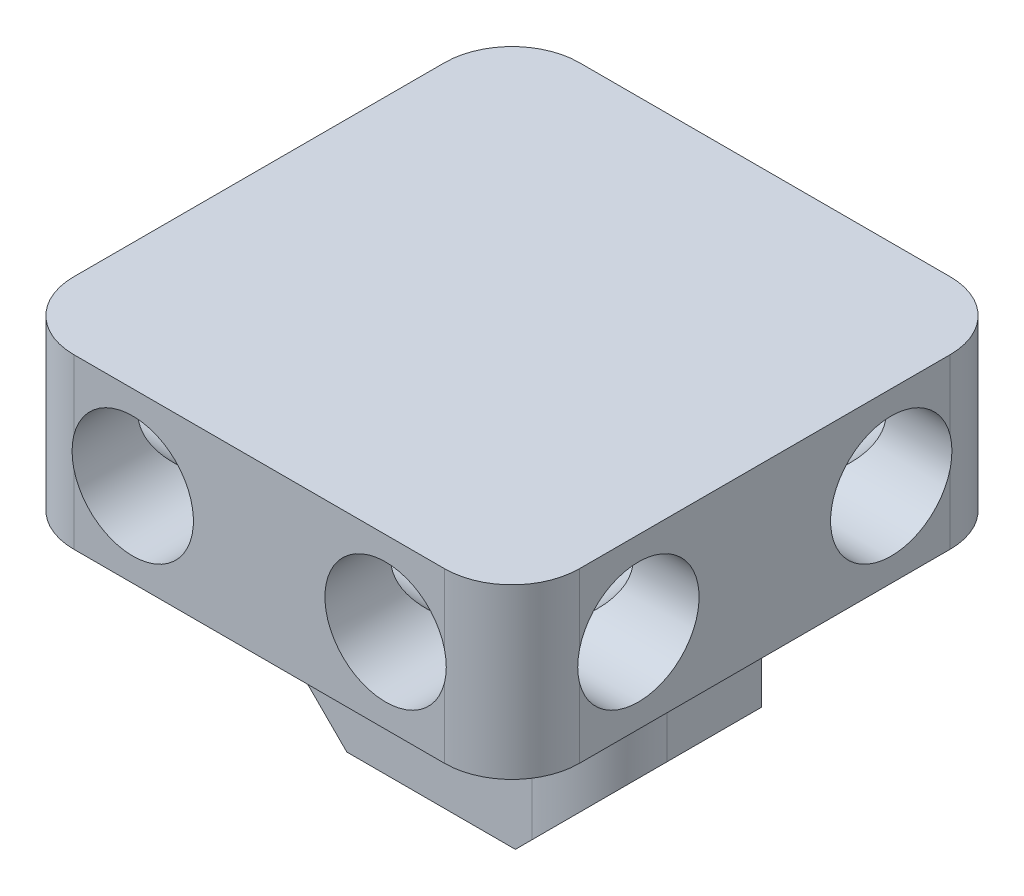
from build123d import *

# Parameters (mm, degrees)
BOSS_EXTRUDE1_DEPTH     = 6.35
CUT_EXTRUDE1_START      = -9.525
SKETCH2_R               = 2.286
SKETCH2_R_2             = 2.285999999999999
CUT_EXTRUDE1_DEPTH      = 19.05
CUT_EXTRUDE2_DEPTH      = 15.892070207999966
CUT_EXTRUDE2_DEPTH_BACK = 15.892070207999966
SKETCH3_R               = 2.286
BOSS_EXTRUDE2_DEPTH     = 3.048
BOSS_EXTRUDE3_REACH     = 17.642
FILLET1_R               = 2.54
FILLET2_R               = 0.762


with BuildPart() as part:
    # Sketch1 → Boss-Extrude1 (new body)
    with BuildSketch(Plane(origin=(0, 0, 0), x_dir=(1, 0, 0), z_dir=(0, 1, 0))):
        with BuildLine():
            Line((6.984999999999984, -9.525000000000002), (-6.98499999999998, -9.525000000000006))
            ThreePointArc((-6.98499999999998, -9.525000000000006), (-8.78105122421383, -8.781051224213837), (-9.524999999999999, -6.984999999999987))
            Line((-9.524999999999999, -6.984999999999987), (-9.524999999999999, 6.984999999999979))
            ThreePointArc((-9.524999999999999, 6.984999999999979), (-8.78105122421383, 8.781051224213828), (-6.984999999999981, 9.524999999999997))
            Line((-6.984999999999981, 9.524999999999997), (6.984999999999984, 9.525))
            ThreePointArc((6.984999999999984, 9.525), (8.781051224213833, 8.781051224213831), (9.525000000000002, 6.984999999999983))
            Line((9.525000000000002, 6.984999999999983), (9.525000000000002, -6.984999999999984))
            ThreePointArc((9.525000000000002, -6.984999999999984), (8.781051224213833, -8.781051224213833), (6.984999999999984, -9.525000000000002))
        make_face()
    extrude(amount=BOSS_EXTRUDE1_DEPTH)

    # Sketch2 → Cut-Extrude1 (cut)
    with BuildSketch(Plane.XY.offset(CUT_EXTRUDE1_START)):
        with Locations(Location((-4.7624999999999975, 3.175, 0), (0, 0, 166.463797263))):
            Circle(SKETCH2_R)
        with Locations(Location((4.762500000000003, 3.175, 0), (0, 0, 13.536202737))):
            Circle(SKETCH2_R_2)
    extrude(amount=CUT_EXTRUDE1_DEPTH, mode=Mode.SUBTRACT)

    # Sketch3 → Cut-Extrude2 (cut, two sides: drawn at the far end of the back side and taken through both)
    with BuildSketch(Plane(origin=(0, 0, 0), x_dir=(0, 0, -1), z_dir=(1, 0, 0)).offset(-CUT_EXTRUDE2_DEPTH_BACK)):
        with Locations(Location((-4.7625, 3.175, 0), (0, 0, 90))):
            Circle(SKETCH3_R)
        with Locations(Location((4.7625, 3.175, 0), (0, 0, 90))):
            Circle(SKETCH3_R)
    extrude(amount=CUT_EXTRUDE2_DEPTH + CUT_EXTRUDE2_DEPTH_BACK, mode=Mode.SUBTRACT)


with BuildPart() as body_2:
    # Sketch4 → Boss-Extrude2 (new, symmetric)
    with BuildSketch(Plane.XY):
        Polygon((-6.35, -3.175), (6.35, -3.1749999999999985), (6.350000000000001, -4.775199999999996), (3.175, -7.950199999999998), (-3.174999999999998, -7.950199999999998), (-6.35, -4.775199999999998), align=None)
    extrude(amount=BOSS_EXTRUDE2_DEPTH, both=True)

    # Sketch5 → Boss-Extrude3 (add, up to next)
    with BuildSketch(Plane.XZ, mode=Mode.PRIVATE) as boss_extrude3_sk1:
        with BuildLine():
            Line((3.0479999999999996, -3.0479999999999996), (0, -3.048))
            ThreePointArc((0, -3.048), (-2.155261469056597, -2.155261469056597), (-3.0479999999999996, 4.3e-16))
            Line((-3.0479999999999996, 4.3e-16), (-3.048000000000001, 3.048))
            Line((-3.048000000000001, 3.048), (0, 3.048))
            ThreePointArc((0, 3.048), (2.1552614690565965, 2.155261469056597), (3.0479999999999996, 4.3e-16))
            Line((3.0479999999999996, 4.3e-16), (3.0479999999999996, -3.0479999999999996))
        make_face()
    boss_extrude3_tool1 = extrude(boss_extrude3_sk1.sketch, amount=BOSS_EXTRUDE3_REACH, mode=Mode.PRIVATE) - body_2.part

    add(part.part)  # Boss-Extrude3 merges part
    add(boss_extrude3_tool1.solids().sort_by_distance((0, 0, 0))[0])

    # Sketch6 → Revolve1 (revolve)
    with BuildSketch(Plane.XY):
        with BuildLine():
            Line((-6.349999999999999, -1.016), (-6.349999999999999, 0))
            Line((-6.349999999999999, 0), (-8.889999999999999, 0))
            ThreePointArc((-8.889999999999999, 0), (-7.717831861012163, -0.7525796525304105), (-6.349999999999999, -1.016))
        make_face()
    revolve1 = revolve(axis=Axis((-6.349999999999999, 0, 0), (0, 1, 0)))

    # Mirror1: Revolve1 across plane
    add(revolve1.mirror(Plane(origin=(0, 0, 0), x_dir=(0, 0, 1), z_dir=(1, 0, 0))))

    # Fillet1
    fillet1_edges = [body_2.edges().sort_by_distance(p)[0] for p in [
        (-6.35, -3.975099999999999, -3.048),
        (6.3500000000000005, -3.9750999999999976, 3.048),
    ]]
    fillet(fillet1_edges, radius=FILLET1_R)

    # Fillet2
    # the kernel refuses this fillet: 0.762 mm, written as the material it adds along each edge
    with BuildSketch(Plane(origin=(-6.349999999999999, 0, 0), x_dir=(-1, 0, 0), z_dir=(0, 0, -1))) as fillet2_piece_1:
        with BuildLine():
            CenterArc((2.8284242963176522, -0.762), FILLET2_R, 90, 39.51765279717284)
            ThreePointArc((2.3435515598060546, -0.17417142857142887), (2.443328238479981, -0.08883673664575209), (2.54, 0))
            Line((2.54, 0), (2.8284242963176522, 0))
        make_face()
    revolve(axis=Axis((-6.349999999999999, 0, 0), (0, 1, 0)))
    with BuildSketch(Plane(origin=(6.349999999999999, 0, 0), x_dir=(1, 0, 0), z_dir=(0, 0, -1))) as fillet2_piece_2:
        with BuildLine():
            CenterArc((2.8284242963176522, 0.762), FILLET2_R, 230.48234720282716, 39.51765279717284)
            ThreePointArc((2.3435515598060546, 0.17417142857142887), (2.443328238479981, 0.08883673664575209), (2.54, 0))
            Line((2.54, 0), (2.8284242963176522, 0))
        make_face()
    revolve(axis=Axis((6.349999999999999, 0, 0), (0, -1, 0)))
    # the kernel refuses this fillet: 0.762 mm, written as the material it takes off along each edge
    with BuildSketch(Plane(origin=(3.0479999999999996, 0, -3.0479999999999996), x_dir=(0, 0, 1), z_dir=(0, -1, 0))) as fillet2_2_piece_1:
        with BuildLine():
            CenterArc((FILLET2_R, FILLET2_R), FILLET2_R, 180, 90)
            Line((0, FILLET2_R), (0, 0))
            Line((0, 0), (FILLET2_R, 0))
        make_face()
    extrude(amount=3.174999999999999, mode=Mode.SUBTRACT)
    with BuildSketch(Plane(origin=(-3.048000000000001, 0, 3.048), x_dir=(1, 0, 0), z_dir=(0, -1, 0))) as fillet2_2_piece_2:
        with BuildLine():
            CenterArc((FILLET2_R, -FILLET2_R), FILLET2_R, 90, 90)
            Line((4.4e-16, -FILLET2_R), (0, 0))
            Line((0, 0), (FILLET2_R, 0))
        make_face()
    extrude(amount=3.1749999999999994, mode=Mode.SUBTRACT)
    # the kernel refuses this fillet: 0.762 mm, written as the material it adds along each edge
    with BuildSketch(Plane(origin=(-7.8e-16, 0, -1.55e-15), x_dir=(2.5e-16, 0, -1), z_dir=(1, 0, 2.5e-16))) as fillet2_3_piece_1:
        with BuildLine():
            CenterArc((3.0479999999999983 + FILLET2_R, -FILLET2_R), FILLET2_R, 90, 90)
            Line((3.0479999999999983 + FILLET2_R, 1.1e-16), (3.0479999999999983, 0))
            Line((3.0479999999999983, 0), (3.0479999999999983, -FILLET2_R))
        make_face()
    revolve(axis=Axis((-7.8e-16, 0, -1.55e-15), (0, 1, 0)), revolution_arc=90.00000000000006)
    with BuildSketch(Plane(origin=(2.2859999999999996, 0, -3.0479999999999996), x_dir=(0, -1, -5.8e-16), z_dir=(-1, 0, -1.5e-16))) as fillet2_3_piece_2:
        with BuildLine():
            CenterArc((FILLET2_R, -FILLET2_R), FILLET2_R, 90.00000000000004, 89.99999999999996)
            Line((0, -FILLET2_R), (0, 0))
            Line((0, 0), (FILLET2_R, 0))
        make_face()
    extrude(amount=2.2859999999999996)
    with BuildSketch(Plane(origin=(3.0479999999999996, 0, 4.3e-16), x_dir=(0, -1, 0), z_dir=(0, 0, -1))) as fillet2_3_piece_3:
        with BuildLine():
            CenterArc((FILLET2_R, -FILLET2_R), FILLET2_R, 90, 90)
            Line((-1.1e-16, -FILLET2_R), (0, 0))
            Line((0, 0), (FILLET2_R, 0))
        make_face()
    extrude(amount=2.286)
    with BuildSketch(Plane(origin=(-3.0479999999999996, 0, 4.3e-16), x_dir=(0, -1, 0), z_dir=(-4.4e-16, 0, 1))) as fillet2_3_piece_4:
        with BuildLine():
            CenterArc((FILLET2_R, -FILLET2_R), FILLET2_R, 90, 90)
            Line((-1.1e-16, -FILLET2_R), (0, 0))
            Line((0, 0), (FILLET2_R, 0))
        make_face()
    extrude(amount=2.285999999999999)
    with BuildSketch(Plane(origin=(-2.2e-16, 0, 2.2e-16), x_dir=(7e-17, 0, 1), z_dir=(-1, 0, 7e-17))) as fillet2_3_piece_5:
        with BuildLine():
            CenterArc((3.048 + FILLET2_R, -FILLET2_R), FILLET2_R, 90, 90)
            Line((3.048 + FILLET2_R, 1.1e-16), (3.048, 0))
            Line((3.048, 0), (3.048, -FILLET2_R))
        make_face()
    revolve(axis=Axis((-2.2e-16, 0, 2.2e-16), (0, 1, 0)), revolution_arc=90)
    with BuildSketch(Plane(origin=(-2.2860000000000005, 0, 3.048), x_dir=(0, -1, 0), z_dir=(1, 0, 0))) as fillet2_3_piece_6:
        with BuildLine():
            CenterArc((FILLET2_R, -FILLET2_R), FILLET2_R, 90, 90)
            Line((-4.4e-16, -FILLET2_R), (0, 0))
            Line((0, 0), (FILLET2_R, 0))
        make_face()
    extrude(amount=2.2860000000000005)
    with BuildSketch(Plane(origin=(-2.2860000000000005, 0, 2.286), x_dir=(0, 0, 1), z_dir=(1, 0, 0))) as fillet2_3_piece_7:
        with BuildLine():
            CenterArc((0.762 + FILLET2_R, FILLET2_R), FILLET2_R, 180, 90)
            Line((0.762, FILLET2_R), (0.762, 0))
            Line((0.762, 0), (0.762 + FILLET2_R, 0))
        make_face()
    revolve(axis=Axis((-2.2860000000000005, 0, 2.286), (0, -1, 0)), revolution_arc=90.00000000000004)
    with BuildSketch(Plane(origin=(2.2859999999999996, 0, -2.2859999999999996), x_dir=(1, 0, 0), z_dir=(0, 0, 1))) as fillet2_3_piece_8:
        with BuildLine():
            CenterArc((0.762 + FILLET2_R, -FILLET2_R), FILLET2_R, 90, 90)
            Line((0.762 + FILLET2_R, 1.1e-16), (0.762, 0))
            Line((0.762, 0), (0.762, -FILLET2_R))
        make_face()
    revolve(axis=Axis((2.2859999999999996, 0, -2.2859999999999996), (0, 1, 0)), revolution_arc=90)


solid = body_2.part
